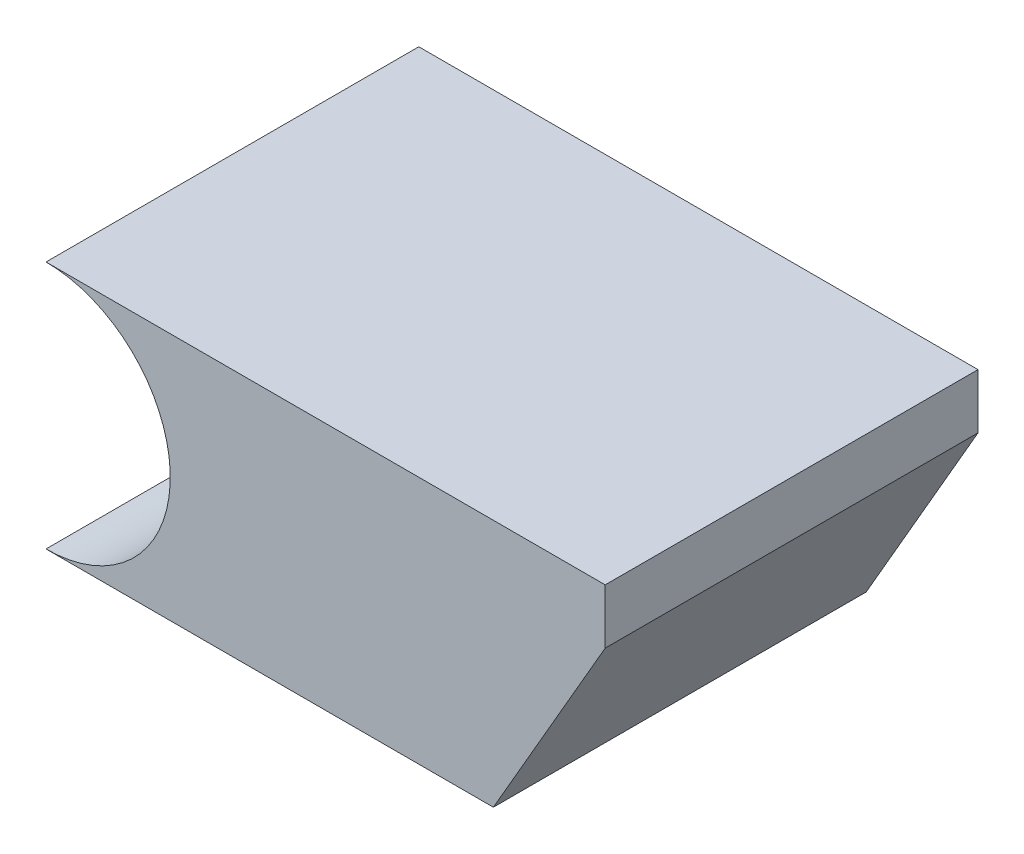
from build123d import *

# Parameters (mm, degrees)
BOSS_EXTRUDE1_DEPTH = 38.1
CHAMFER1_SIZE       = 11.43
CHAMFER1_SIZE2      = 19.797340731


with BuildPart() as part:
    # Sketch1 → Boss-Extrude1 (new body)
    with BuildSketch(Plane.XY):
        with BuildLine():
            Line((0, 0), (57.15, 0))
            Line((57.15, 0), (57.15, 25.4))
            Line((57.15, 25.4), (0, 25.4))
            ThreePointArc((0, 25.4), (12.7, 12.7), (0, 0))
        make_face()
    extrude(amount=BOSS_EXTRUDE1_DEPTH)

    # Chamfer1
    chamfer1_edges = [part.edges().sort_by_distance(p)[0] for p in [
        (57.15, 0, 19.05),
    ]]
    chamfer1_side = [part.faces().sort_by_distance(p)[0] for p in [
        (28.575, 0, 19.05),
    ]]
    chamfer(chamfer1_edges, length=CHAMFER1_SIZE, length2=CHAMFER1_SIZE2, reference=chamfer1_side[0])


solid = part.part
